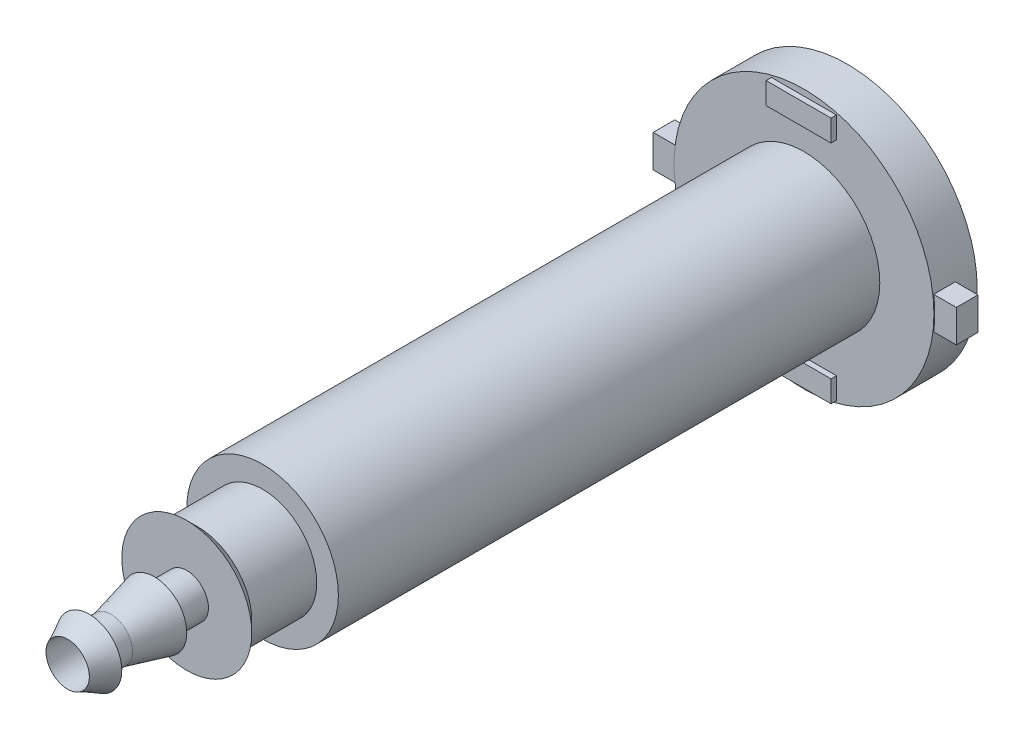
from build123d import *

# Parameters (mm, degrees)
SKETCH1_R           = 9
BOSS_EXTRUDE1_DEPTH = 9
SKETCH2_R           = 7
BOSS_EXTRUDE2_DEPTH = 54
SKETCH3_R           = 12
BOSS_EXTRUDE3_DEPTH = 4
SKETCH4_R           = 5
BOSS_EXTRUDE4_DEPTH = 6
SKETCH5_R           = 2
BOSS_EXTRUDE5_DEPTH = 12
SKETCH6_R           = 6
SKETCH9_R           = 3
SKETCH8_R           = 2
SKETCH10_W          = 6
SKETCH10_H          = 2
BOSS_EXTRUDE6_DEPTH = 0.5
SKETCH11_W          = 2
SKETCH11_H          = 3
BOSS_EXTRUDE7_DEPTH = 3
CIRPATTERN2_COUNT   = 2
SKETCH12_R          = 9
CUT_EXTRUDE1_DEPTH  = 8


with BuildPart() as part:
    # Sketch1 → Boss-Extrude1 (new body)
    with BuildSketch(Plane.XY):
        Circle(SKETCH1_R)
    extrude(amount=BOSS_EXTRUDE1_DEPTH)

    # Sketch2 → Boss-Extrude2 (add)
    with BuildSketch(Plane.XY.offset(9)):
        Circle(SKETCH2_R)
    extrude(amount=BOSS_EXTRUDE2_DEPTH)

    # Sketch3 → Boss-Extrude3 (add)
    with BuildSketch(Plane.XY.offset(9)):
        Circle(SKETCH3_R)
    extrude(amount=BOSS_EXTRUDE3_DEPTH)

    # Sketch4 → Boss-Extrude4 (add)
    with BuildSketch(Plane.XY.offset(63)):
        Circle(SKETCH4_R)
    extrude(amount=BOSS_EXTRUDE4_DEPTH)

    # Sketch5 → Boss-Extrude5 (add)
    with BuildSketch(Plane.XY.offset(69)):
        Circle(SKETCH5_R)
    extrude(amount=BOSS_EXTRUDE5_DEPTH)

    # Sketch6 → section 0 of loft1
    with BuildSketch(Plane.XY.offset(70), mode=Mode.PRIVATE) as loft1_s0:
        Circle(SKETCH6_R)
    # loft up to a face of the part (loft1)
    loft([loft1_s0.sketch, Face(Wire([part.edges().sort_by_distance((-3.42273553, 3.644843137, 69))[0]]))])

    # Loft2: read off the stored shape, not the designer's step
    # Loft2: loft between two sections, ruled curve by curve
    loft2_from = [
        Edge.make_bspline([(2.575484484, 1.538466663, 79), (-0.501448843, 6.689435631, 79), (-5.652417811, 3.612502304, 79), (-2.575484484, -1.538466663, 79), (0.501448843, -6.689435631, 79), (5.652417811, -3.612502304, 79), (2.575484484, 1.538466663, 79)], [0, 0, 0, 0, 0.5, 0.5, 0.5, 1, 1, 1, 1], 3, [1, 0.333333333, 0.333333333, 1, 0.333333333, 0.333333333, 1]),
    ]
    loft2_to = [
        Edge.make_bspline([(1.968242689, 0.354993967, 81), (1.258254754, 4.291479346, 81), (-2.678230624, 3.581491411, 81), (-1.968242689, -0.354993967, 81), (-1.258254754, -4.291479346, 81), (2.678230624, -3.581491411, 81), (1.968242689, 0.354993967, 81)], [0, 0, 0, 0, 0.5, 0.5, 0.5, 1, 1, 1, 1], 3, [1, 0.333333333, 0.333333333, 1, 0.333333333, 0.333333333, 1]),
    ]
    loft2 = Solid(Shell([*[Face.make_surface_from_curves(loft2_from[k], loft2_to[k]) for k in range(1)], Face(Wire(loft2_from)), Face(Wire(loft2_to))]))
    add(loft2)

    # Sketch9 → Loft3 section 0
    with BuildSketch(Plane.XY.offset(73)):
        Circle(SKETCH9_R)
    # Sketch8 → Loft3 section 1
    with BuildSketch(Plane.XY.offset(77)):
        Circle(SKETCH8_R)
    loft()

    # Sketch10 → Boss-Extrude6 (add)
    with BuildSketch(Plane.XY.offset(13)):
        with Locations((0, 10.428217705)):
            Rectangle(SKETCH10_W, SKETCH10_H)
    boss_extrude6 = extrude(amount=BOSS_EXTRUDE6_DEPTH)

    # Sketch11 → Boss-Extrude7 (add)
    with BuildSketch(Plane(origin=(11, 0, 0), x_dir=(0, 0, -1), z_dir=(1, 0, 0))):
        with Locations((-11.929859907, 0)):
            Rectangle(SKETCH11_W, SKETCH11_H)
    boss_extrude7 = extrude(amount=BOSS_EXTRUDE7_DEPTH)

    # CirPattern2: Boss-Extrude6, Boss-Extrude7 ×2 about axis
    cirpattern2_axis = Axis((0, 0, 0), (0, 0, 1))
    add([boss_extrude6.rotate(cirpattern2_axis, i * 360 / CIRPATTERN2_COUNT) for i in range(1, CIRPATTERN2_COUNT)])
    add([boss_extrude7.rotate(cirpattern2_axis, i * 360 / CIRPATTERN2_COUNT) for i in range(1, CIRPATTERN2_COUNT)])

    # Sketch12 → Cut-Extrude1 (cut)
    with BuildSketch(Plane(origin=(0, 0, 0), x_dir=(-1, 0, 0), z_dir=(0, 0, -1))):
        Circle(SKETCH12_R)
    extrude(amount=-CUT_EXTRUDE1_DEPTH, mode=Mode.SUBTRACT)

    # Cut-Loft1: read off the stored shape, not the designer's step
    # Cut-Loft1: loft between two sections, ruled curve by curve
    cut_loft1_from = [
        Edge.make_bspline([(-0.428925161, 1.953464411, 81), (3.478003662, 2.811314733, 81), (4.335853984, -1.09561409, 81), (0.428925161, -1.953464411, 81), (-3.478003662, -2.811314733, 81), (-4.335853984, 1.09561409, 81), (-0.428925161, 1.953464411, 81)], [0, 0, 0, 0, 0.5, 0.5, 0.5, 1, 1, 1, 1], 3, [1, 0.333333333, 0.333333333, 1, 0.333333333, 0.333333333, 1]),
    ]
    cut_loft1_to = [
        Edge.make_bspline([(2.310337756, 1.913723975, 8), (6.137785706, -2.706951537, 8), (1.517110194, -6.534399487, 8), (-2.310337756, -1.913723975, 8), (-6.137785706, 2.706951537, 8), (-1.517110194, 6.534399487, 8), (2.310337756, 1.913723975, 8)], [0, 0, 0, 0, 0.5, 0.5, 0.5, 1, 1, 1, 1], 3, [1, 0.333333333, 0.333333333, 1, 0.333333333, 0.333333333, 1]),
    ]
    cut_loft1 = Solid(Shell([*[Face.make_surface_from_curves(cut_loft1_from[k], cut_loft1_to[k]) for k in range(1)], Face(Wire(cut_loft1_from)), Face(Wire(cut_loft1_to))]))
    add(cut_loft1, mode=Mode.SUBTRACT)


solid = part.part
